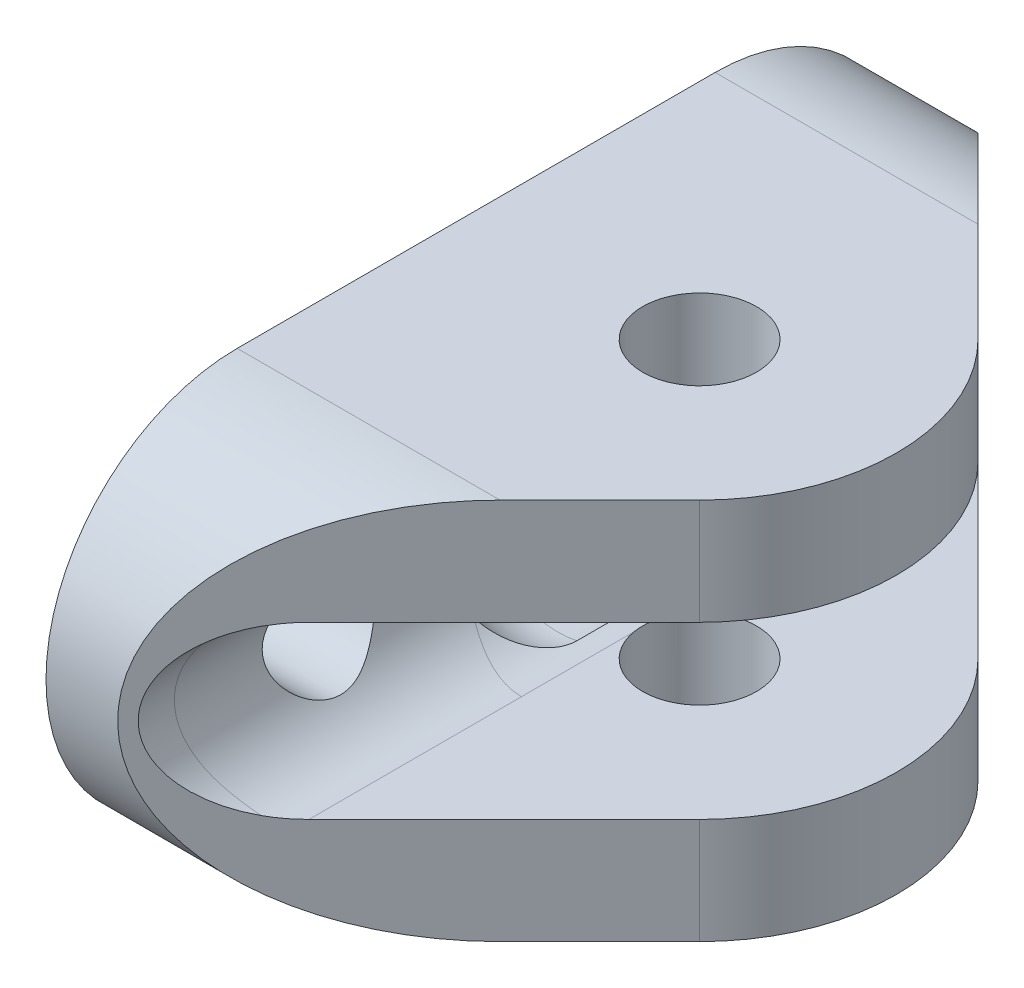
from build123d import *

# Parameters (mm, degrees)
SKETCH1_R               = 4.7625
BOSS_EXTRUDE1_DEPTH     = 50
CUT_EXTRUDE3_DEPTH      = 64.655321851
CUT_EXTRUDE3_DEPTH_BACK = 64.655321851
CUT_EXTRUDE2_DEPTH      = 53.814032144
CUT_EXTRUDE2_DEPTH_BACK = 53.814032144
SKETCH5_R               = 4.7625
CUT_EXTRUDE4_DEPTH      = 53.814032144
CUT_EXTRUDE4_DEPTH_BACK = 53.814032144


with BuildPart() as part:
    # Sketch1 → Boss-Extrude1 (new body)
    with BuildSketch(Plane(origin=(0, 0, 0), x_dir=(0, 0, -1), z_dir=(1, 0, 0))):
        with BuildLine():
            Line((-20, 16), (0, 16))
            Line((0, 16), (20, 16))
            ThreePointArc((20, 16), (36, 0), (20, -16))
            Line((20, -16), (0, -16))
            Line((0, -16), (-20, -16))
            ThreePointArc((-20, -16), (-36, 0), (-20, 16))
        make_face()
        with Locations((-20, 0)):
            Circle(SKETCH1_R, mode=Mode.SUBTRACT)
        with Locations((20, 0)):
            Circle(SKETCH1_R, mode=Mode.SUBTRACT)
    extrude(amount=BOSS_EXTRUDE1_DEPTH)

    # Sketch3 → Cut-Extrude3 (cut, two sides: drawn at the far end of the back side and taken through both)
    with BuildSketch(Plane(origin=(0, 0, 0), x_dir=(1, 0, 0), z_dir=(0, 1, 0)).offset(-CUT_EXTRUDE3_DEPTH_BACK)):
        with BuildLine():
            Line((6, 36), (30.35, 11.65))
            ThreePointArc((30.35, 11.65), (35.175588002, 0), (30.35, -11.65))
            Line((30.35, -11.65), (6, -36))
            Line((6, -36), (6, -40.720576269))
            Line((6, -40.720576269), (53.537884165, -40.720576269))
            Line((53.537884165, -40.720576269), (53.537884165, 49.648939658))
            Line((53.537884165, 49.648939658), (6, 49.648939658))
            Line((6, 49.648939658), (6, 36))
        make_face()
    extrude(amount=CUT_EXTRUDE3_DEPTH + CUT_EXTRUDE3_DEPTH_BACK, mode=Mode.SUBTRACT)

    # Sketch5 → Cut-Extrude2 (cut, two sides: drawn at the far end of the back side and taken through both)
    with BuildSketch(Plane(origin=(0, 0, 0), x_dir=(1, 0, 0), z_dir=(0, 1, 0)).offset(-CUT_EXTRUDE2_DEPTH_BACK)):
        with Locations((18.7, 0)):
            Circle(SKETCH5_R)
    extrude(amount=CUT_EXTRUDE2_DEPTH + CUT_EXTRUDE2_DEPTH_BACK, mode=Mode.SUBTRACT)

    # Sketch7 → Cut-Extrude4 (cut, two sides: drawn at the far end of the back side and taken through both)
    with BuildSketch(Plane.XY.offset(-CUT_EXTRUDE4_DEPTH_BACK)):
        with BuildLine():
            Line((56.351176003, -7.14375), (14, -7.14375))
            ThreePointArc((14, -7.14375), (6.85625, 0), (14, 7.14375))
            Line((14, 7.14375), (56.351176003, 7.14375))
            ThreePointArc((56.351176003, 7.14375), (63.494926003, 0), (56.351176003, -7.14375))
        make_face()
    extrude(amount=CUT_EXTRUDE4_DEPTH + CUT_EXTRUDE4_DEPTH_BACK, mode=Mode.SUBTRACT)

    # Sketch10 → Cut-Revolve1 (revolve, cut)
    with BuildSketch(Plane(origin=(0, 0, 0), x_dir=(1, 0, 0), z_dir=(0, 1, 0))):
        with BuildLine():
            Line((3.7, 4), (3.7, -4))
            ThreePointArc((3.7, -4), (5.794186515, -9.055813485), (10.85, -11.15))
            Line((10.85, -11.15), (10.85, 11.15))
            ThreePointArc((10.85, 11.15), (5.794186515, 9.055813485), (3.7, 4))
        make_face()
    revolve(axis=Axis((10.85, 0, -11.15), (0, 0, 1)), mode=Mode.SUBTRACT)


solid = part.part
